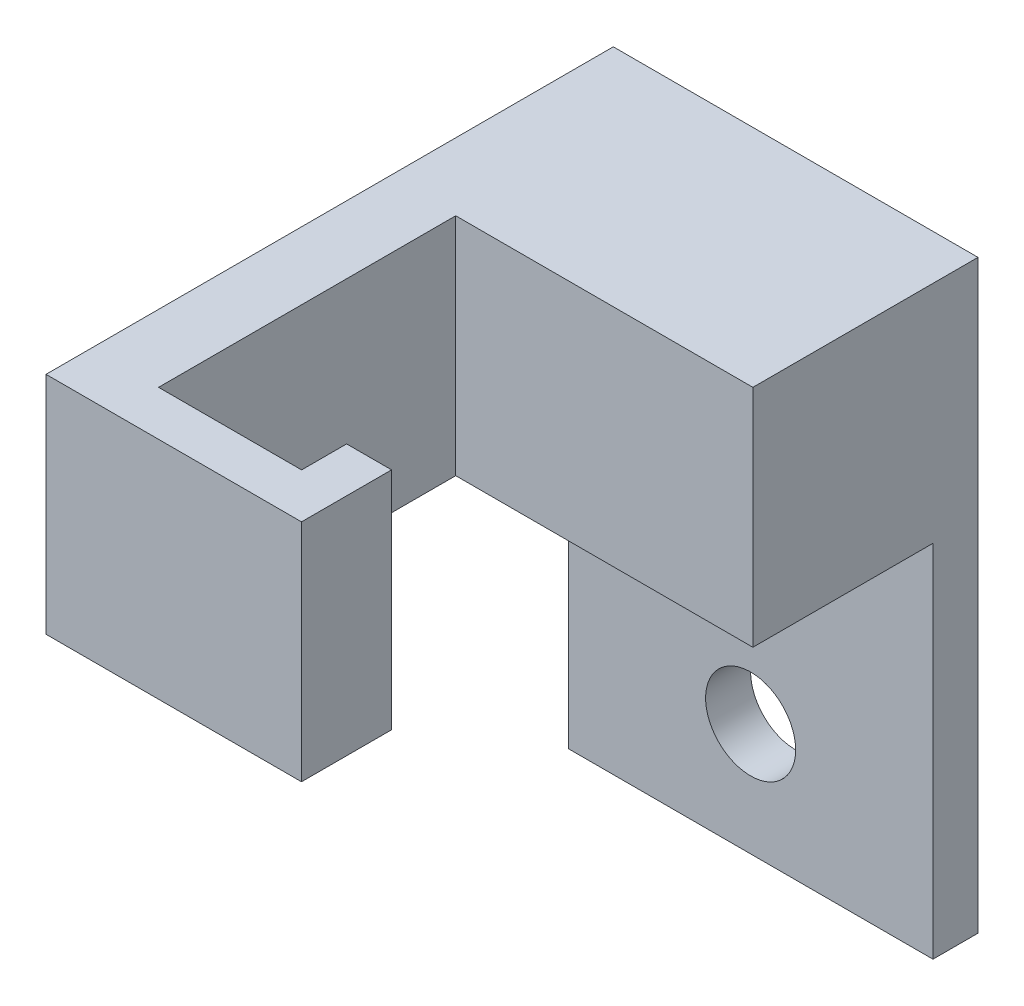
from build123d import *

# Parameters (mm, degrees)
SKETCH1_W            = 16.2
SKETCH1_H            = 16
SKETCH1_R            = 2
BOSS_EXTRUDE3_DEPTH  = 2
SKETCH1_3_W          = 3
SKETCH1_3_H          = 10
BOSS_EXTRUDE4_DEPTH  = 17
SKETCH1_4_W          = 2
SKETCH1_4_H          = 2
BOSS_EXTRUDE5_DEPTH  = 1.5
SKETCH1_6_W          = 13.2
SKETCH1_6_H          = 10
BOSS_EXTRUDE8_DEPTH  = 10
SKETCH1_7_W          = 3
SKETCH1_7_H          = 10
BOSS_EXTRUDE9_DEPTH  = 25.2
BOSS_EXTRUDE10_DEPTH = 10


with BuildPart() as part:
    # Sketch1 → Boss-Extrude3 (new body)
    with BuildSketch(Plane.XY):
        with Locations((0, -5)):
            Rectangle(SKETCH1_W, SKETCH1_H)
        with Locations((0, -8)):
            Circle(SKETCH1_R, mode=Mode.SUBTRACT)
    extrude(amount=BOSS_EXTRUDE3_DEPTH)

    # Sketch1<3> → Boss-Extrude4 (add)
    with BuildSketch(Plane.XY):
        with Locations((-6.6, 8)):
            Rectangle(SKETCH1_3_W, SKETCH1_3_H)
    extrude(amount=BOSS_EXTRUDE4_DEPTH)

    # Sketch1<4> → Boss-Extrude5 (add)
    with BuildSketch(Plane.XY):
        with Locations((0, -2)):
            Rectangle(SKETCH1_4_W, SKETCH1_4_H)
    extrude(amount=-BOSS_EXTRUDE5_DEPTH)

    # Sketch1<6> → Boss-Extrude8 (add)
    with BuildSketch(Plane.XY):
        with Locations((1.5, 8)):
            Rectangle(SKETCH1_6_W, SKETCH1_6_H)
    extrude(amount=BOSS_EXTRUDE8_DEPTH)

    # Sketch1<7> → Boss-Extrude9 (add)
    with BuildSketch(Plane.XY):
        with Locations((-6.6, 8)):
            Rectangle(SKETCH1_7_W, SKETCH1_7_H)
    extrude(amount=BOSS_EXTRUDE9_DEPTH)

    # Sketch4 → Boss-Extrude10 (add)
    with BuildSketch(Plane(origin=(0, 13, 0), x_dir=(1, 0, 0), z_dir=(0, 1, 0))):
        Polygon((-5.1, -23.2), (-5.1, -25.2), (1.25451398, -25.2), (3.25, -25.2), (3.25, -22.2), (3.25, -21.2), (1.25451398, -21.2), (1.25451398, -23.2), align=None)
    extrude(amount=-BOSS_EXTRUDE10_DEPTH)


solid = part.part
